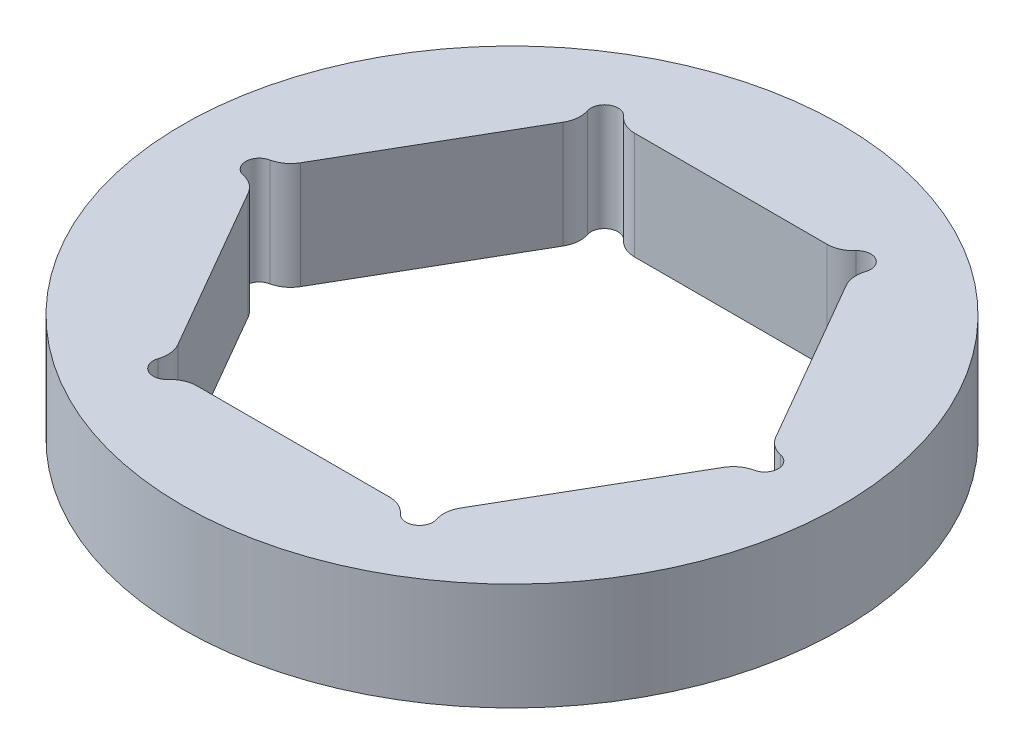
from build123d import *

# Parameters (mm, degrees)
CROQUIS1_R              = 9.7536
SALIENTE_EXTRUIR1_DEPTH = 1.5875


with BuildPart() as part:
    # Croquis1 → Saliente-Extruir1 (new, symmetric)
    with BuildSketch(Plane(origin=(0, 0, 0), x_dir=(1, 0, 0), z_dir=(0, 1, 0))):
        Circle(CROQUIS1_R)
        with BuildLine():
            Line((4.186711289, -5.702403331), (7.031781792, -0.774596669))
            ThreePointArc((7.031781792, -0.774596669), (7.255445899, -0.526605585), (7.560864296, -0.391532223))
            ThreePointArc((7.560864296, -0.391532223), (7.878995387, 0), (7.560864296, 0.391532223))
            ThreePointArc((7.560864296, 0.391532223), (7.255445899, 0.526605585), (7.031781792, 0.774596669))
            Line((7.031781792, 0.774596669), (4.186711289, 5.702403331))
            ThreePointArc((4.186711289, 5.702403331), (4.083776764, 6.020097672), (4.119509, 6.352134444))
            ThreePointArc((4.119509, 6.352134444), (3.939497694, 6.823410162), (3.441355297, 6.743666667))
            ThreePointArc((3.441355297, 6.743666667), (3.171669135, 6.546703257), (2.845070503, 6.477))
            Line((2.845070503, 6.477), (-2.845070503, 6.477))
            ThreePointArc((-2.845070503, 6.477), (-3.171669135, 6.546703257), (-3.441355297, 6.743666667))
            ThreePointArc((-3.441355297, 6.743666667), (-3.939497694, 6.823410162), (-4.119509, 6.352134444))
            ThreePointArc((-4.119509, 6.352134444), (-4.083776764, 6.020097672), (-4.186711289, 5.702403331))
            Line((-4.186711289, 5.702403331), (-7.031781792, 0.774596669))
            ThreePointArc((-7.031781792, 0.774596669), (-7.255445899, 0.526605585), (-7.560864296, 0.391532223))
            ThreePointArc((-7.560864296, 0.391532223), (-7.878995387, 0), (-7.560864296, -0.391532223))
            ThreePointArc((-7.560864296, -0.391532223), (-7.255445899, -0.526605585), (-7.031781792, -0.774596669))
            Line((-7.031781792, -0.774596669), (-4.186711289, -5.702403331))
            ThreePointArc((-4.186711289, -5.702403331), (-4.083776764, -6.020097672), (-4.119509, -6.352134444))
            ThreePointArc((-4.119509, -6.352134444), (-3.939497694, -6.823410162), (-3.441355297, -6.743666667))
            ThreePointArc((-3.441355297, -6.743666667), (-3.171669135, -6.546703257), (-2.845070503, -6.477))
            Line((-2.845070503, -6.477), (2.845070503, -6.477))
            ThreePointArc((2.845070503, -6.477), (3.171669135, -6.546703257), (3.441355297, -6.743666667))
            ThreePointArc((3.441355297, -6.743666667), (3.939497694, -6.823410162), (4.119509, -6.352134444))
            ThreePointArc((4.119509, -6.352134444), (4.083776764, -6.020097672), (4.186711289, -5.702403331))
        make_face(mode=Mode.SUBTRACT)
    extrude(amount=SALIENTE_EXTRUIR1_DEPTH, both=True)


solid = part.part
